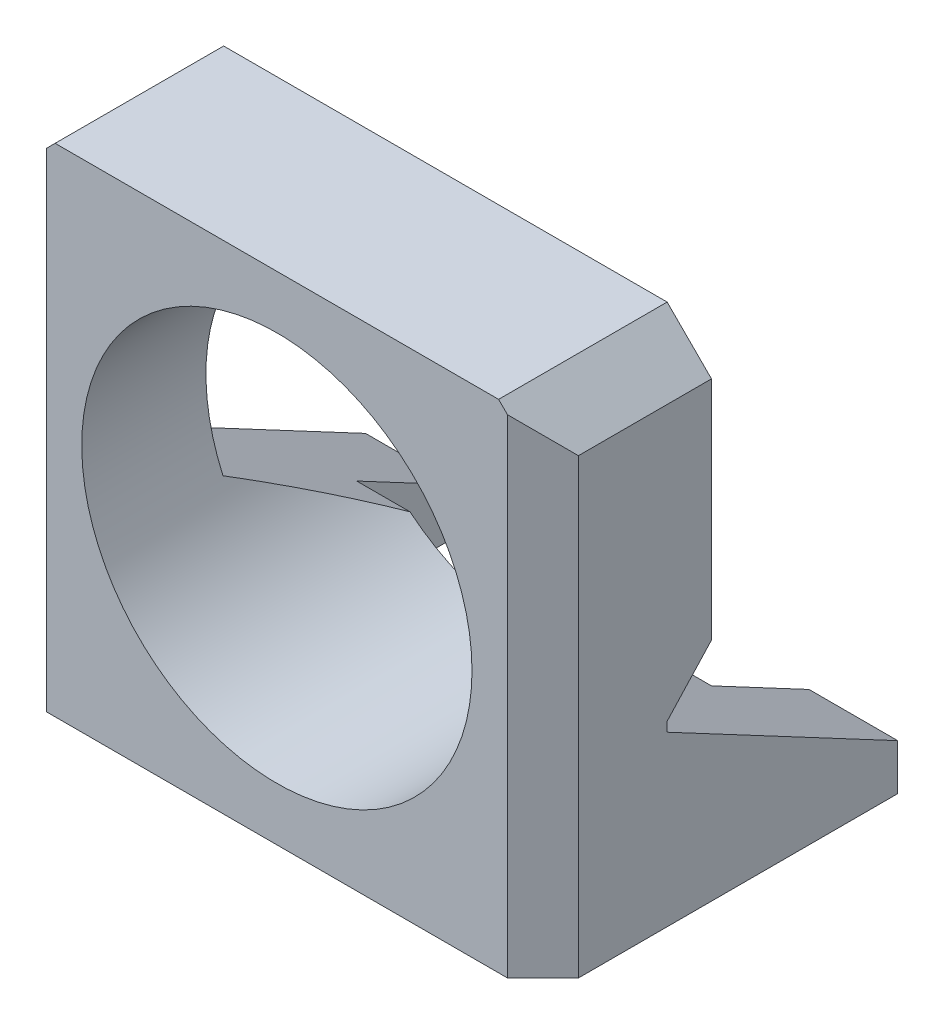
from build123d import *

# Parameters (mm, degrees)
SKETCH1_R           = 11
BOSS_EXTRUDE1_DEPTH = 7
SKETCH2_W           = 5
SKETCH2_H           = 2.5
BOSS_EXTRUDE2_DEPTH = 13
CHAMFER2_SIZE       = 2
BOSS_EXTRUDE6_DEPTH = 2.5
CHAMFER3_SIZE       = 2
CHAMFER4_SIZE       = 2
BOSS_EXTRUDE4_DEPTH = 2.5
CHAMFER6_SIZE       = 2.5
CHAMFER7_SIZE       = 7
CHAMFER7_SIZE_2     = 13.165085257
CUT_EXTRUDE1_START  = -3
SKETCH6_R           = 1.5
CUT_EXTRUDE1_DEPTH  = 2.5
SKETCH7_R           = 1.5
CUT_EXTRUDE2_DEPTH  = 6


with BuildPart() as part:
    # Sketch1 → Boss-Extrude1 (new body)
    with BuildSketch(Plane.XY):
        Polygon((-15, 11.5), (-12.5, 14), (12.5, 14), (15, 11.5), (15, -14), (-15, -14), align=None)
        Circle(SKETCH1_R, mode=Mode.SUBTRACT)
    extrude(amount=BOSS_EXTRUDE1_DEPTH)

    # Sketch2 → Boss-Extrude2 (add)
    with BuildSketch(Plane(origin=(0, 0, 0), x_dir=(-1, 0, 0), z_dir=(0, 0, -1))):
        with Locations((-12.5, -12.75)):
            Rectangle(SKETCH2_W, SKETCH2_H)
        with Locations((12.5, -12.75)):
            Rectangle(SKETCH2_W, SKETCH2_H)
    extrude(amount=BOSS_EXTRUDE2_DEPTH)

    # Chamfer2
    chamfer2_edges = [part.edges().sort_by_distance(p)[0] for p in [
        (-10, -12.75, 0),
        (10, -12.75, 0),
    ]]
    chamfer(chamfer2_edges, length=CHAMFER2_SIZE)

    # Sketch5 → Boss-Extrude6 (add)
    with BuildSketch(Plane.XZ.offset(14)):
        Polygon((-10, -2), (-10, -7.5), (10, -7.5), (10, -2), (8, 0), (-8, 0), align=None)
    extrude(amount=-BOSS_EXTRUDE6_DEPTH)

    # Chamfer3
    chamfer3_edges = [part.edges().sort_by_distance(p)[0] for p in [
        (15, -1.25, 7),
    ]]
    chamfer(chamfer3_edges, length=CHAMFER3_SIZE)

    # Chamfer4
    chamfer4_edges = [part.edges().sort_by_distance(p)[0] for p in [
        (-15, -1.25, 7),
    ]]
    chamfer(chamfer4_edges, length=CHAMFER4_SIZE)

    # Sketch4 → Boss-Extrude4 (add)
    with BuildSketch(Plane(origin=(0, 0, 0), x_dir=(-1, 0, 0), z_dir=(0, 0, -1))):
        Polygon((-15, -1.25), (15, 11.5), (12.5, 14), (-12.5, 14), (-15, 11.5), align=None)
    extrude(amount=BOSS_EXTRUDE4_DEPTH)

    # Chamfer6
    # the kernel refuses this chamfer: 2.5 mm, written as the material it adds along each edge
    with BuildSketch(Plane(origin=(20.916998416, -3.764724327, 0), x_dir=(-0.39099275668343275, -0.9199829569021947, 0.02749587661058635), z_dir=(-0.9203309184584746, 0.39114064034485174, 0))) as chamfer6_piece_1_section:
        Polygon((CHAMFER6_SIZE * 0.999621916911, -CHAMFER6_SIZE * 0.0274958766106), (-CHAMFER6_SIZE * 0.0274958766106, -CHAMFER6_SIZE * 0.999621916911), (0, 0), align=None)
    chamfer6_piece_1 = extrude(amount=17.214861222, mode=Mode.PRIVATE)
    chamfer6_piece_1 = chamfer6_piece_1 - Plane(origin=(0, 0, -0.830769879), x_dir=(1, 0, 0), z_dir=(0, 0, -1)) * Cylinder(11, 45, mode=Mode.PRIVATE)
    chamfer6_piece_1 = split(chamfer6_piece_1, bisect_by=Plane(origin=(15, -1.305255327, -0.830769879), z_dir=(-1, 0, 0)), keep=Keep.TOP, mode=Mode.PRIVATE)
    add(chamfer6_piece_1)
    with BuildSketch(Plane(origin=(-1.383846422, 5.71313473, 0), x_dir=(-0.39099275668343275, -0.9199829569021946, 0.02749587661058637), z_dir=(-0.9203309184584746, 0.39114064034485174, 0))) as chamfer6_piece_2_section:
        Polygon((CHAMFER6_SIZE * 0.999621916911, -CHAMFER6_SIZE * 0.0274958766106), (-CHAMFER6_SIZE * 0.0274958766106, -CHAMFER6_SIZE * 0.999621916911), (0, 0), align=None)
    chamfer6_piece_2 = extrude(amount=21.224052785, mode=Mode.PRIVATE)
    chamfer6_piece_2 = chamfer6_piece_2 - Plane(origin=(0, 0, -0.851096237), x_dir=(1, 0, 0), z_dir=(0, 0, -1)) * Cylinder(11, 53, mode=Mode.PRIVATE)
    chamfer6_piece_2 = split(chamfer6_piece_2, bisect_by=Plane(origin=(-15, 9.126408424, -0.851096237), z_dir=(1, 0, 0)), keep=Keep.TOP, mode=Mode.PRIVATE)
    add(chamfer6_piece_2)

    # Chamfer7
    # the kernel refuses this chamfer: 13.165085257, 7 mm, written as the material it adds along each edge
    with BuildSketch(Plane(origin=(-15, -11.5, 0), x_dir=(0, 0.9979482451756082, 0.06402577567608186), z_dir=(1, 0, 0))) as chamfer7_piece_1_section:
        Polygon((CHAMFER7_SIZE * 0.997948245176, -CHAMFER7_SIZE * 0.0640257756761), (-CHAMFER7_SIZE_2 * 0.0640257756781, -CHAMFER7_SIZE_2 * 0.997948245208), (0, 0), align=None)
    chamfer7_piece_1 = extrude(amount=30, mode=Mode.PRIVATE)
    chamfer7_piece_1 = chamfer7_piece_1 - Plane(origin=(0, 0, -3.073682767), x_dir=(1, 0, 0), z_dir=(0, 0, -1)) * Cylinder(11, 113, mode=Mode.PRIVATE)
    chamfer7_piece_1 = split(chamfer7_piece_1, bisect_by=Plane(origin=(-12.500128058, -8.887755394, -7.5), z_dir=(0, 0, 1)), keep=Keep.TOP, mode=Mode.PRIVATE)
    chamfer7_piece_1 = split(chamfer7_piece_1, bisect_by=Plane(origin=(-10, -8.887755394, -3.073682767), z_dir=(-1, 0, 0)), keep=Keep.TOP, mode=Mode.PRIVATE)
    add(chamfer7_piece_1)
    with BuildSketch(Plane(origin=(-15, -11.5, 0), x_dir=(0, 0.9979482451756082, 0.06402577567608186), z_dir=(1, 0, 0))) as chamfer7_piece_2_section:
        Polygon((CHAMFER7_SIZE * 0.997948245176, -CHAMFER7_SIZE * 0.0640257756761), (-CHAMFER7_SIZE_2 * 0.0640257756781, -CHAMFER7_SIZE_2 * 0.997948245208), (0, 0), align=None)
    chamfer7_piece_2 = extrude(amount=30, mode=Mode.PRIVATE)
    chamfer7_piece_2 = split(chamfer7_piece_2, bisect_by=Plane(origin=(-12.5, -10.721530873, -7.5), z_dir=(0, 0, -1)), keep=Keep.TOP, mode=Mode.PRIVATE)
    chamfer7_piece_2 = split(chamfer7_piece_2, bisect_by=Plane(origin=(-10, -10.721530873, -9.597564575), z_dir=(-1, 0, 0)), keep=Keep.TOP, mode=Mode.PRIVATE)
    chamfer7_piece_2 = split(chamfer7_piece_2, bisect_by=Plane(origin=(-12.5, -10.721530873, -13), z_dir=(0, 0, 1)), keep=Keep.TOP, mode=Mode.PRIVATE)
    add(chamfer7_piece_2)
    with BuildSketch(Plane(origin=(-15, -11.5, 0), x_dir=(0, 0.9979482451756082, 0.06402577567608186), z_dir=(1, 0, 0))) as chamfer7_piece_3_section:
        Polygon((CHAMFER7_SIZE * 0.997948245176, -CHAMFER7_SIZE * 0.0640257756761), (-CHAMFER7_SIZE_2 * 0.0640257756781, -CHAMFER7_SIZE_2 * 0.997948245208), (0, 0), align=None)
    chamfer7_piece_3 = extrude(amount=30, mode=Mode.PRIVATE)
    chamfer7_piece_3 = chamfer7_piece_3 - Plane(origin=(0, 0, -3.793876077), x_dir=(1, 0, 0), z_dir=(0, 0, -1)) * Cylinder(11, 113, mode=Mode.PRIVATE)
    chamfer7_piece_3 = split(chamfer7_piece_3, bisect_by=Plane(origin=(-9.499486782, -6.598719884, -7.5), z_dir=(0, 0, 1)), keep=Keep.TOP, mode=Mode.PRIVATE)
    chamfer7_piece_3 = split(chamfer7_piece_3, bisect_by=Plane(origin=(10, -6.598719884, -3.793876077), z_dir=(-1, 0, 0)), keep=Keep.TOP, mode=Mode.PRIVATE)
    chamfer7_piece_3 = split(chamfer7_piece_3, bisect_by=Plane(origin=(-10, -6.598719884, -3.793876077), z_dir=(1, 0, 0)), keep=Keep.TOP, mode=Mode.PRIVATE)
    add(chamfer7_piece_3)
    with BuildSketch(Plane(origin=(-15, -11.5, 0), x_dir=(0, 0.9979482451756082, 0.06402577567608186), z_dir=(1, 0, 0))) as chamfer7_piece_4_section:
        Polygon((CHAMFER7_SIZE * 0.997948245176, -CHAMFER7_SIZE * 0.0640257756761), (-CHAMFER7_SIZE_2 * 0.0640257756781, -CHAMFER7_SIZE_2 * 0.997948245208), (0, 0), align=None)
    chamfer7_piece_4 = extrude(amount=30, mode=Mode.PRIVATE)
    chamfer7_piece_4 = split(chamfer7_piece_4, bisect_by=Plane(origin=(12.5, -10.721530873, -7.5), z_dir=(0, 0, -1)), keep=Keep.TOP, mode=Mode.PRIVATE)
    chamfer7_piece_4 = split(chamfer7_piece_4, bisect_by=Plane(origin=(10, -10.721530873, -9.597564575), z_dir=(1, 0, 0)), keep=Keep.TOP, mode=Mode.PRIVATE)
    chamfer7_piece_4 = split(chamfer7_piece_4, bisect_by=Plane(origin=(12.5, -10.721530873, -13), z_dir=(0, 0, 1)), keep=Keep.TOP, mode=Mode.PRIVATE)
    add(chamfer7_piece_4)
    with BuildSketch(Plane(origin=(-15, -11.5, 0), x_dir=(0, 0.9979482451756082, 0.06402577567608186), z_dir=(1, 0, 0))) as chamfer7_piece_5_section:
        Polygon((CHAMFER7_SIZE * 0.997948245176, -CHAMFER7_SIZE * 0.0640257756761), (-CHAMFER7_SIZE_2 * 0.0640257756781, -CHAMFER7_SIZE_2 * 0.997948245208), (0, 0), align=None)
    chamfer7_piece_5 = extrude(amount=30, mode=Mode.PRIVATE)
    chamfer7_piece_5 = chamfer7_piece_5 - Plane(origin=(0, 0, -3.073682766), x_dir=(1, 0, 0), z_dir=(0, 0, -1)) * Cylinder(11, 113, mode=Mode.PRIVATE)
    chamfer7_piece_5 = split(chamfer7_piece_5, bisect_by=Plane(origin=(12.500128057, -8.887755394, -7.5), z_dir=(0, 0, 1)), keep=Keep.TOP, mode=Mode.PRIVATE)
    chamfer7_piece_5 = split(chamfer7_piece_5, bisect_by=Plane(origin=(10, -8.887755394, -3.073682766), z_dir=(1, 0, 0)), keep=Keep.TOP, mode=Mode.PRIVATE)
    add(chamfer7_piece_5)

    # Sketch6 → Cut-Extrude1 (cut)
    # profile 1 of 2: a face of its own
    with BuildSketch(Plane.XZ.offset(14).offset(CUT_EXTRUDE1_START)):
        Polygon((-8.3, 0.941154273), (-8.3, 4.058845727), (-11, 5.617691454), (-13.7, 4.058845727), (-13.7, 0.941154273), (-11, -0.617691454), align=None)
        with Locations(Location((-11, 2.5, 0), (0, 0, 270))):
            Circle(SKETCH6_R, mode=Mode.SUBTRACT)
    # profile 2 of 2: a face of its own
    with BuildSketch(Plane.XZ.offset(14).offset(CUT_EXTRUDE1_START)):
        Polygon((11, -0.617691454), (8.3, 0.941154273), (8.3, 4.058845727), (11, 5.617691454), (13.7, 4.058845727), (13.7, 0.941154273), align=None)
    extrude(amount=-CUT_EXTRUDE1_DEPTH, mode=Mode.SUBTRACT)

    # Sketch7 → Cut-Extrude2 (cut)
    with BuildSketch(Plane.XZ.offset(14)):
        with Locations(Location((11, 2.5, 0), (0, 0, 270))):
            Circle(SKETCH7_R)
        with Locations(Location((-11, 2.5, 0), (0, 0, 270))):
            Circle(SKETCH7_R)
    extrude(amount=-CUT_EXTRUDE2_DEPTH, mode=Mode.SUBTRACT)


solid = part.part
